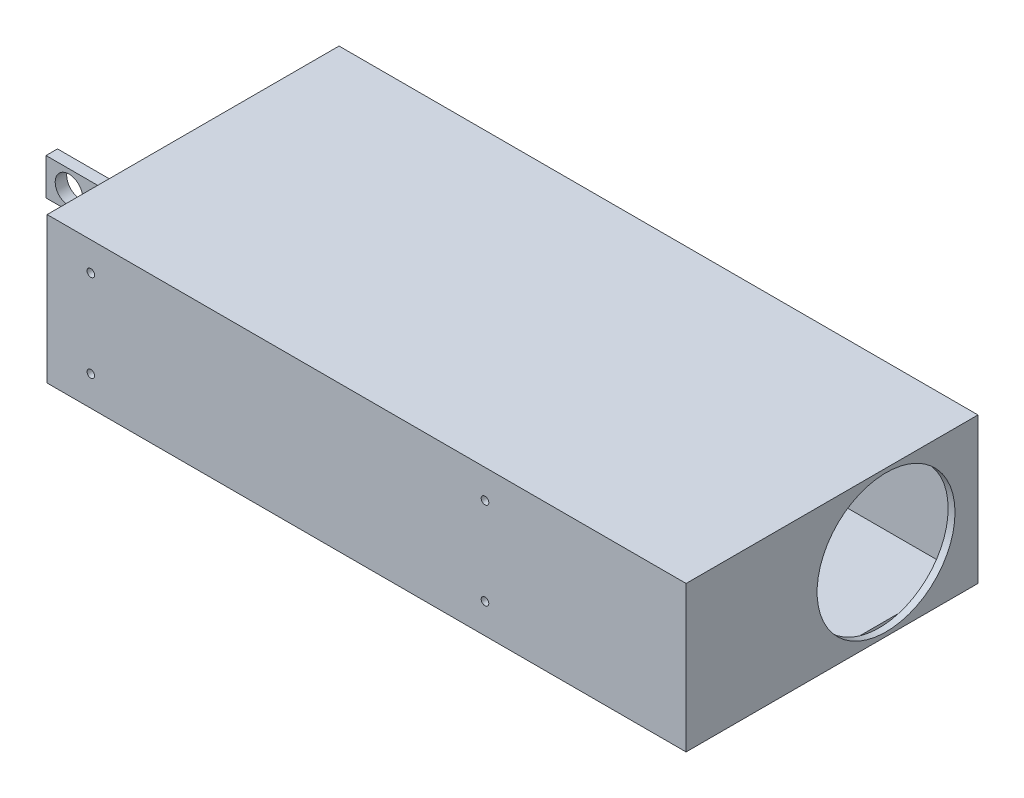
from build123d import *

# Parameters (mm, degrees)
SKETCH1_W                      = 278
SKETCH1_H                      = 127
BOSS_EXTRUDE1_DEPTH            = 63.5
SKETCH7_R                      = 30
CUT_EXTRUDE1_DEPTH             = 3
SHELL1_START                   = -136
SHELL1_OUTLINE_W               = 57.5
SHELL1_OUTLINE_H               = 121
SHELL1_DEPTH                   = 272
M4X0_7_TAPPED_HOLE1_D          = 3.3
M4X0_7_TAPPED_HOLE1_DEPTH      = 10.1
M4X0_7_TAPPED_HOLE1_TIP        = 0.991420021
M4X0_7_TAPPED_HOLE2_AT_2_COUNT = 2
M4X0_7_TAPPED_HOLE2_AT_2_PITCH = 175.659471706
M4X0_7_TAPPED_HOLE2_AT_3_COUNT = 2
M4X0_7_TAPPED_HOLE2_AT_3_PITCH = 171.5
M4X0_7_TAPPED_HOLE2_AT_4_COUNT = 2
M4X0_7_TAPPED_HOLE2_AT_4_PITCH = 38
SKETCH6_W                      = 5
SKETCH6_H                      = 16
BOSS_EXTRUDE2_DEPTH            = 39
SKETCH8_R                      = 6
CUT_EXTRUDE2_DEPTH             = 202.018655851
SKETCH9_W                      = 8
SKETCH9_H                      = 5
CUT_EXTRUDE3_DEPTH             = 4


# Read off the part's stored shape, not the designer's step: Shell1
with BuildPart() as part:
    # Sketch1 → Boss-Extrude1 (new body)
    with BuildSketch(Plane(origin=(0, 0, 0), x_dir=(1, 0, 0), z_dir=(0, 1, 0))):
        Rectangle(SKETCH1_W, SKETCH1_H)
    extrude(amount=BOSS_EXTRUDE1_DEPTH)

    # Sketch7 → Cut-Extrude1 (cut)
    with BuildSketch(Plane(origin=(139, 0, 0), x_dir=(0, 0, -1), z_dir=(1, 0, 0))):
        with Locations((23.5, 31.75)):
            Circle(SKETCH7_R)
    extrude(amount=-CUT_EXTRUDE1_DEPTH, mode=Mode.SUBTRACT)

    # Shell1 outline → Shell1 (cut)
    with BuildSketch(Plane.YZ.offset(SHELL1_START)):
        with Locations((31.75, 0)):
            Rectangle(SHELL1_OUTLINE_W, SHELL1_OUTLINE_H)
    extrude(amount=SHELL1_DEPTH, mode=Mode.SUBTRACT)

    # M4x0.7 Tapped Hole1
    with Locations(Plane(origin=(0, 0, 0), x_dir=(-1, 0, 0), z_dir=(0, -1, 0))):
        with Locations((120, -50.25), (-51.5, 51.25), (-51.5, -50.25), (120, 51.25)):
            Hole(M4X0_7_TAPPED_HOLE1_D / 2, depth=M4X0_7_TAPPED_HOLE1_DEPTH)
            with Locations((0, 0, -(M4X0_7_TAPPED_HOLE1_DEPTH + M4X0_7_TAPPED_HOLE1_TIP / 2))):  # 118° drill point
                Cone(0, M4X0_7_TAPPED_HOLE1_D / 2, M4X0_7_TAPPED_HOLE1_TIP, mode=Mode.SUBTRACT)

    # Sketch5 → M4x0.7 Tapped Hole2 (revolve, cut)
    with BuildSketch(Plane(origin=(-120, 13, -63.5), x_dir=(0, 1, 0), z_dir=(1, 0, 0))):
        Polygon((0, 0), (0, 11.091420021), (1.65, 10.1), (1.65, 0), align=None)
    m4x0_7_tapped_hole2 = revolve(axis=Axis((-120, 13, -69.85), (0, 0, 1)), mode=Mode.SUBTRACT)

    # M4x0.7 Tapped Hole2 at 2: M4x0.7 Tapped Hole2 ×2
    with Locations(*[Vector(0.9763208230930155, 0.2163276459331463, 0) * (i * M4X0_7_TAPPED_HOLE2_AT_2_PITCH) for i in range(1, M4X0_7_TAPPED_HOLE2_AT_2_COUNT)]):
        add(m4x0_7_tapped_hole2, mode=Mode.SUBTRACT)

    # M4x0.7 Tapped Hole2 at 3: M4x0.7 Tapped Hole2 ×2
    with Locations(*[(i * M4X0_7_TAPPED_HOLE2_AT_3_PITCH, 0, 0) for i in range(1, M4X0_7_TAPPED_HOLE2_AT_3_COUNT)]):
        add(m4x0_7_tapped_hole2, mode=Mode.SUBTRACT)

    # M4x0.7 Tapped Hole2 at 4: M4x0.7 Tapped Hole2 ×2
    with Locations(*[(0, i * M4X0_7_TAPPED_HOLE2_AT_4_PITCH, 0) for i in range(1, M4X0_7_TAPPED_HOLE2_AT_4_COUNT)]):
        add(m4x0_7_tapped_hole2, mode=Mode.SUBTRACT)

    # Mirror1: M4x0.7 Tapped Hole2 across plane
    add(m4x0_7_tapped_hole2.mirror(Plane.XY), mode=Mode.SUBTRACT)

    # Mirror1 copy 1 sketch → Mirror1 copy 1 (revolve, cut)
    with BuildSketch(Plane(origin=(51.5, 51, 63.5), x_dir=(0, 1, 0), z_dir=(1, 0, 0))):
        Polygon((0, 0), (0, -11.091420021), (1.65, -10.1), (1.65, 0), align=None)
    revolve(axis=Axis((51.5, 51, 69.85), (0, 0, 1)), mode=Mode.SUBTRACT)

    # Mirror1 copy 2 sketch → Mirror1 copy 2 (revolve, cut)
    with BuildSketch(Plane(origin=(51.5, 13, 63.5), x_dir=(0, 1, 0), z_dir=(1, 0, 0))):
        Polygon((0, 0), (0, -11.091420021), (1.65, -10.1), (1.65, 0), align=None)
    revolve(axis=Axis((51.5, 13, 69.85), (0, 0, 1)), mode=Mode.SUBTRACT)

    # Mirror1 copy 3 sketch → Mirror1 copy 3 (revolve, cut)
    with BuildSketch(Plane(origin=(-120, 51, 63.5), x_dir=(0, 1, 0), z_dir=(1, 0, 0))):
        Polygon((0, 0), (0, -11.091420021), (1.65, -10.1), (1.65, 0), align=None)
    revolve(axis=Axis((-120, 51, 69.85), (0, 0, 1)), mode=Mode.SUBTRACT)

    # Sketch6 → Boss-Extrude2 (add)
    with BuildSketch(Plane.ZY.offset(139)):
        with Locations((-2.5, 13)):
            Rectangle(SKETCH6_W, SKETCH6_H)
        with Locations((22.5, 39)):
            Rectangle(SKETCH6_W, SKETCH6_H)
    extrude(amount=BOSS_EXTRUDE2_DEPTH)

    # Sketch8 → Cut-Extrude2 (cut, through all)
    with BuildSketch(Plane(origin=(0, 0, -5), x_dir=(-1, 0, 0), z_dir=(0, 0, -1))):
        with Locations((168, 13)):
            Circle(SKETCH8_R)
        with Locations((168, 39)):
            Circle(SKETCH8_R)
    extrude(amount=-CUT_EXTRUDE2_DEPTH, mode=Mode.SUBTRACT)

    # Sketch9 → Cut-Extrude3 (cut)
    with BuildSketch(Plane.ZY.offset(139)):
        with Locations((-51.5, 5.5)):
            Rectangle(SKETCH9_W, SKETCH9_H)
        with Locations((-41.2, 5.5)):
            Rectangle(SKETCH9_W, SKETCH9_H)
        with Locations((-30.9, 5.5)):
            Rectangle(SKETCH9_W, SKETCH9_H)
        with Locations((-20.6, 5.5)):
            Rectangle(SKETCH9_W, SKETCH9_H)
        with Locations((10.3, 5.5)):
            Rectangle(SKETCH9_W, SKETCH9_H)
        with Locations((20.6, 5.5)):
            Rectangle(SKETCH9_W, SKETCH9_H)
        with Locations((30.9, 5.5)):
            Rectangle(SKETCH9_W, SKETCH9_H)
        with Locations((41.2, 5.5)):
            Rectangle(SKETCH9_W, SKETCH9_H)
        with Locations((51.5, 5.5)):
            Rectangle(SKETCH9_W, SKETCH9_H)
        with Locations((-46.35, 12.8)):
            Rectangle(SKETCH9_W, SKETCH9_H)
        with Locations((-56.65, 12.8)):
            Rectangle(SKETCH9_W, SKETCH9_H)
        with Locations((-36.05, 12.8)):
            Rectangle(SKETCH9_W, SKETCH9_H)
        with Locations((-25.75, 12.8)):
            Rectangle(SKETCH9_W, SKETCH9_H)
        with Locations((-15.45, 12.8)):
            Rectangle(SKETCH9_W, SKETCH9_H)
        with Locations((-41.2, 20.1)):
            Rectangle(SKETCH9_W, SKETCH9_H)
        with Locations((-51.5, 20.1)):
            Rectangle(SKETCH9_W, SKETCH9_H)
        with Locations((5.15, 12.8)):
            Rectangle(SKETCH9_W, SKETCH9_H)
        with Locations((15.45, 12.8)):
            Rectangle(SKETCH9_W, SKETCH9_H)
        with Locations((25.75, 12.8)):
            Rectangle(SKETCH9_W, SKETCH9_H)
        with Locations((36.05, 12.8)):
            Rectangle(SKETCH9_W, SKETCH9_H)
        with Locations((46.35, 12.8)):
            Rectangle(SKETCH9_W, SKETCH9_H)
        with Locations((56.65, 12.8)):
            Rectangle(SKETCH9_W, SKETCH9_H)
        with Locations((-56.65, 27.4)):
            Rectangle(SKETCH9_W, SKETCH9_H)
        with Locations((-51.5, 34.7)):
            Rectangle(SKETCH9_W, SKETCH9_H)
        with Locations((-56.65, 42)):
            Rectangle(SKETCH9_W, SKETCH9_H)
        with Locations((-51.5, 49.3)):
            Rectangle(SKETCH9_W, SKETCH9_H)
        with Locations((-56.65, 56.6)):
            Rectangle(SKETCH9_W, SKETCH9_H)
        with Locations((-30.9, 20.1)):
            Rectangle(SKETCH9_W, SKETCH9_H)
        with Locations((-20.6, 20.1)):
            Rectangle(SKETCH9_W, SKETCH9_H)
        with Locations((10.3, 20.1)):
            Rectangle(SKETCH9_W, SKETCH9_H)
        with Locations((20.6, 20.1)):
            Rectangle(SKETCH9_W, SKETCH9_H)
        with Locations((30.9, 20.1)):
            Rectangle(SKETCH9_W, SKETCH9_H)
        with Locations((41.2, 20.1)):
            Rectangle(SKETCH9_W, SKETCH9_H)
        with Locations((51.5, 20.1)):
            Rectangle(SKETCH9_W, SKETCH9_H)
        with Locations((-46.35, 27.4)):
            Rectangle(SKETCH9_W, SKETCH9_H)
        with Locations((-36.05, 27.4)):
            Rectangle(SKETCH9_W, SKETCH9_H)
        with Locations((-25.75, 27.4)):
            Rectangle(SKETCH9_W, SKETCH9_H)
        with Locations((-15.45, 27.4)):
            Rectangle(SKETCH9_W, SKETCH9_H)
        with Locations((-5.15, 27.4)):
            Rectangle(SKETCH9_W, SKETCH9_H)
        with Locations((5.15, 27.4)):
            Rectangle(SKETCH9_W, SKETCH9_H)
        with Locations((15.45, 27.4)):
            Rectangle(SKETCH9_W, SKETCH9_H)
        with Locations((25.75, 27.4)):
            Rectangle(SKETCH9_W, SKETCH9_H)
        with Locations((36.05, 27.4)):
            Rectangle(SKETCH9_W, SKETCH9_H)
        with Locations((46.35, 27.4)):
            Rectangle(SKETCH9_W, SKETCH9_H)
        with Locations((56.65, 27.4)):
            Rectangle(SKETCH9_W, SKETCH9_H)
        with Locations((-41.2, 34.7)):
            Rectangle(SKETCH9_W, SKETCH9_H)
        with Locations((-30.9, 34.7)):
            Rectangle(SKETCH9_W, SKETCH9_H)
        with Locations((-20.6, 34.7)):
            Rectangle(SKETCH9_W, SKETCH9_H)
        with Locations((-10.3, 34.7)):
            Rectangle(SKETCH9_W, SKETCH9_H)
        with Locations((0, 34.7)):
            Rectangle(SKETCH9_W, SKETCH9_H)
        with Locations((30.9, 34.7)):
            Rectangle(SKETCH9_W, SKETCH9_H)
        with Locations((41.2, 34.7)):
            Rectangle(SKETCH9_W, SKETCH9_H)
        with Locations((51.5, 34.7)):
            Rectangle(SKETCH9_W, SKETCH9_H)
        with Locations((-46.35, 42)):
            Rectangle(SKETCH9_W, SKETCH9_H)
        with Locations((-36.05, 42)):
            Rectangle(SKETCH9_W, SKETCH9_H)
        with Locations((-25.75, 42)):
            Rectangle(SKETCH9_W, SKETCH9_H)
        with Locations((-15.45, 42)):
            Rectangle(SKETCH9_W, SKETCH9_H)
        with Locations((-5.15, 42)):
            Rectangle(SKETCH9_W, SKETCH9_H)
        with Locations((5.15, 42)):
            Rectangle(SKETCH9_W, SKETCH9_H)
        with Locations((36.05, 42)):
            Rectangle(SKETCH9_W, SKETCH9_H)
        with Locations((46.35, 42)):
            Rectangle(SKETCH9_W, SKETCH9_H)
        with Locations((56.65, 42)):
            Rectangle(SKETCH9_W, SKETCH9_H)
        with Locations((-41.2, 49.3)):
            Rectangle(SKETCH9_W, SKETCH9_H)
        with Locations((-20.6, 49.3)):
            Rectangle(SKETCH9_W, SKETCH9_H)
        with Locations((-10.3, 49.3)):
            Rectangle(SKETCH9_W, SKETCH9_H)
        with Locations((0, 49.3)):
            Rectangle(SKETCH9_W, SKETCH9_H)
        with Locations((10.3, 49.3)):
            Rectangle(SKETCH9_W, SKETCH9_H)
        with Locations((-46.35, 56.6)):
            Rectangle(SKETCH9_W, SKETCH9_H)
        with Locations((-15.45, 56.6)):
            Rectangle(SKETCH9_W, SKETCH9_H)
        with Locations((-5.15, 56.6)):
            Rectangle(SKETCH9_W, SKETCH9_H)
        with Locations((5.15, 56.6)):
            Rectangle(SKETCH9_W, SKETCH9_H)
    extrude(amount=-CUT_EXTRUDE3_DEPTH, mode=Mode.SUBTRACT)


solid = part.part
